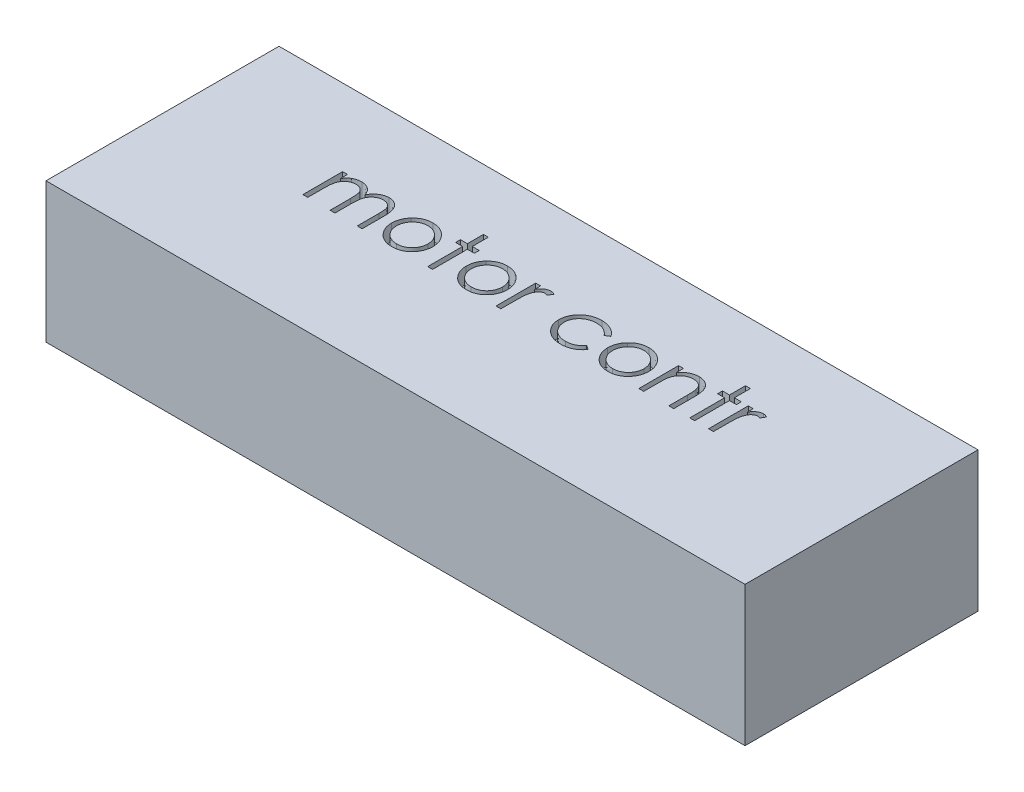
from build123d import *

# Parameters (mm, degrees)
SKETCH1_W           = 45
SKETCH1_H           = 15
BOSS_EXTRUDE1_DEPTH = 9
CUT_EXTRUDE1_DEPTH  = 1


with BuildPart() as part:
    # Sketch1 → Boss-Extrude1 (new body)
    with BuildSketch(Plane(origin=(0, 0, 0), x_dir=(1, 0, 0), z_dir=(0, 1, 0))):
        Rectangle(SKETCH1_W, SKETCH1_H)
    extrude(amount=BOSS_EXTRUDE1_DEPTH)

    # Sketch2 → Cut-Extrude1 (cut)
    # profile 1 of 10: a face of its own
    with BuildSketch(Plane(origin=(0, 9, 0), x_dir=(1, 0, 0), z_dir=(0, 1, 0))):
        with BuildLine():
            Line((-13.461538462, 2.557692308), (-13.147435897, 2.557692308))
            Line((-13.147435897, 2.557692308), (-13.147435897, 2.11318109))
            add(Edge.make_bspline(
                [(-13.147435897, 2.11318109), (-13.119151948, 2.152068691), (-13.064957188, 2.226581065), (-12.976091535, 2.324771349), (-12.887315423, 2.408099503), (-12.823382041, 2.451842375), (-12.792668269, 2.472856571)],
                knots=[0, 0, 0, 0, 1.134379233, 2.173579362, 3.122582517, 4, 4, 4, 4], degree=3))
            add(Edge.make_bspline(
                [(-12.792668269, 2.472856571), (-12.750803607, 2.492861936), (-12.667805707, 2.532523149), (-12.536386482, 2.572756708), (-12.401911813, 2.597481809), (-12.311103599, 2.600863183), (-12.265424679, 2.602564103)],
                knots=[0, 0, 0, 0, 1.014936303, 2.012140481, 3.000054389, 4, 4, 4, 4], degree=3))
            add(Edge.make_bspline(
                [(-12.265424679, 2.602564103), (-12.234531683, 2.601518812), (-12.173396104, 2.599450238), (-12.082812014, 2.585990202), (-11.994953402, 2.562724029), (-11.910339373, 2.530316705), (-11.830618693, 2.491070018), (-11.757529496, 2.445020311), (-11.691905287, 2.393323235), (-11.633779236, 2.333644302), (-11.581510211, 2.264307704), (-11.533431364, 2.183443455), (-11.489006152, 2.089235794), (-11.464384843, 2.020869253), (-11.451422276, 1.984875801)],
                knots=[0, 0, 0, 0, 1.009824226, 1.998387844, 2.986035974, 3.974953746, 4.955485308, 5.885931332, 6.793869504, 7.679848016, 8.601185859, 9.625726857, 10.749998409, 12, 12, 12, 12], degree=3))
            add(Edge.make_bspline(
                [(-11.451422276, 1.984875801), (-11.437711024, 2.009600221), (-11.410729207, 2.058254406), (-11.36542357, 2.127112668), (-11.317955774, 2.19151946), (-11.267921281, 2.251525884), (-11.215496694, 2.306835614), (-11.160435293, 2.357631516), (-11.103050512, 2.40413173), (-11.023258272, 2.458454889), (-10.919445665, 2.516156071), (-10.78855755, 2.566184515), (-10.652407378, 2.597100643), (-10.55998968, 2.600730916), (-10.513321314, 2.602564103)],
                knots=[0, 0, 0, 0, 0.86119277, 1.694706429, 2.50939023, 3.298075842, 4.073795165, 4.829715201, 5.57930267, 6.321991688, 7.768977793, 9.186738141, 10.579381044, 12, 12, 12, 12], degree=3))
            add(Edge.make_bspline(
                [(-10.513321314, 2.602564103), (-10.470439851, 2.600946882), (-10.386516665, 2.597781823), (-10.264339399, 2.57292835), (-10.150397594, 2.530250703), (-10.044920518, 2.472017066), (-9.949760704, 2.398837883), (-9.867044395, 2.311769046), (-9.797274032, 2.211426423), (-9.751695392, 2.117034434), (-9.720780128, 2.033699101), (-9.701718894, 1.96269281), (-9.684879199, 1.884541257), (-9.670897953, 1.799150995), (-9.660679401, 1.706220387), (-9.653108686, 1.605901511), (-9.647984612, 1.498116399), (-9.64762254, 1.423750899), (-9.647435897, 1.385416667)],
                knots=[0, 0, 0, 0, 1.209669288, 2.367440248, 3.500751976, 4.631527125, 5.755587489, 6.87532382, 8.007944318, 9.190864318, 9.82315674, 10.514484317, 11.263564316, 12.079023757, 12.955305781, 13.901327259, 14.918167583, 16, 16, 16, 16], degree=3))
            Line((-9.647435897, 1.385416667), (-9.647435897, 0))
            Line((-9.647435897, 0), (-9.961538462, 0))
            Line((-9.961538462, 0), (-9.961538462, 1.38681891))
            add(Edge.make_bspline(
                [(-9.961538462, 1.38681891), (-9.961616345, 1.419539484), (-9.961766024, 1.482423451), (-9.964459655, 1.572675902), (-9.969534969, 1.654944259), (-9.975469608, 1.729116348), (-9.983713418, 1.795365136), (-9.994359349, 1.853557555), (-10.005637029, 1.904151366), (-10.02437302, 1.960237414), (-10.054320912, 2.022107624), (-10.099938392, 2.0888312), (-10.157408498, 2.146912), (-10.223768655, 2.197330317), (-10.299317099, 2.238323958), (-10.382581823, 2.267599968), (-10.473045874, 2.285722846), (-10.535668663, 2.287528862), (-10.568008814, 2.288461538)],
                knots=[0, 0, 0, 0, 1.253487763, 2.409012846, 3.458416907, 4.410876679, 5.259312806, 6.014470957, 6.676830364, 7.243083969, 8.276244668, 9.299465089, 10.325150304, 11.392391894, 12.482080715, 13.603491619, 14.762376348, 16, 16, 16, 16], degree=3))
            add(Edge.make_bspline(
                [(-10.568008814, 2.288461538), (-10.607678768, 2.287045381), (-10.68608168, 2.284246516), (-10.800527166, 2.255672643), (-10.910498182, 2.212592392), (-11.012713315, 2.150159935), (-11.106741106, 2.075351571), (-11.187640684, 1.986401975), (-11.254472869, 1.885772048), (-11.299726845, 1.792625346), (-11.328316147, 1.708955902), (-11.347193062, 1.63585853), (-11.361876454, 1.552776962), (-11.375646983, 1.460269472), (-11.384634711, 1.357699291), (-11.392803083, 1.24554089), (-11.396623946, 1.123456931), (-11.397158405, 1.038830242), (-11.397435897, 0.994891827)],
                knots=[0, 0, 0, 0, 1.090531906, 2.155305635, 3.229839962, 4.33261226, 5.44038871, 6.529323825, 7.629011124, 8.757537029, 9.370236727, 10.061839251, 10.834451254, 11.692844982, 12.636905849, 13.66920014, 14.789842145, 16, 16, 16, 16], degree=3))
            Line((-11.397435897, 0.994891827), (-11.397435897, 0))
            Line((-11.397435897, 0), (-11.711538462, 0))
            Line((-11.711538462, 0), (-11.711538462, 1.300580929))
            add(Edge.make_bspline(
                [(-11.711538462, 1.300580929), (-11.711617893, 1.337274248), (-11.71177071, 1.407868505), (-11.714447027, 1.509102181), (-11.719533649, 1.601183261), (-11.725414197, 1.684004725), (-11.733874376, 1.757416053), (-11.743484138, 1.821810811), (-11.754832748, 1.877027563), (-11.773622633, 1.937590947), (-11.802337101, 2.00431187), (-11.848525363, 2.075452892), (-11.906132944, 2.137720989), (-11.973703819, 2.190879738), (-12.049709502, 2.234821219), (-12.133692902, 2.266480971), (-12.224897815, 2.28490526), (-12.287775521, 2.287253757), (-12.320112179, 2.288461538)],
                knots=[0, 0, 0, 0, 1.320475261, 2.540461679, 3.643808994, 4.639130445, 5.527981419, 6.302341397, 6.981980563, 7.553956391, 8.582137848, 9.585246428, 10.591171744, 11.620968678, 12.668337649, 13.738356861, 14.836885341, 16, 16, 16, 16], degree=3))
            add(Edge.make_bspline(
                [(-12.320112179, 2.288461538), (-12.358128391, 2.286931078), (-12.43389335, 2.283880926), (-12.54519532, 2.256426652), (-12.652681004, 2.213422577), (-12.754635702, 2.153762758), (-12.848309851, 2.07986368), (-12.930318118, 1.992948784), (-12.999260644, 1.89409975), (-13.044992458, 1.801935234), (-13.074490933, 1.720361959), (-13.094086267, 1.651011011), (-13.110925893, 1.574010763), (-13.123439915, 1.489123652), (-13.13552033, 1.396902558), (-13.141350639, 1.296888068), (-13.147022202, 1.18916598), (-13.147294616, 1.114793435), (-13.147435897, 1.076221955)],
                knots=[0, 0, 0, 0, 1.098833095, 2.189935336, 3.297829714, 4.440610912, 5.596351641, 6.740013378, 7.886572111, 9.072425424, 9.705826452, 10.395263256, 11.156850408, 11.985370555, 12.878090359, 13.847760091, 14.883794034, 16, 16, 16, 16], degree=3))
            Line((-13.147435897, 1.076221955), (-13.147435897, 0))
            Line((-13.147435897, 0), (-13.461538462, 0))
            Line((-13.461538462, 0), (-13.461538462, 2.557692308))
        make_face()
    # profile 2 of 10: a face of its own
    with BuildSketch(Plane(origin=(0, 9, 0), x_dir=(1, 0, 0), z_dir=(0, 1, 0))):
        with BuildLine():
            add(Edge.make_bspline(
                [(-7.694110577, 2.602564103), (-7.646119304, 2.601542211), (-7.552020147, 2.599538533), (-7.414212261, 2.578123567), (-7.282667125, 2.545376203), (-7.156880933, 2.500104641), (-7.038464637, 2.43942269), (-6.925693393, 2.367013399), (-6.818876384, 2.281230805), (-6.754853355, 2.214872737), (-6.722355769, 2.181189904)],
                knots=[0, 0, 0, 0, 1.054011418, 2.066658804, 3.057071809, 4.030435133, 4.997543892, 5.974964718, 6.972108034, 8, 8, 8, 8], degree=3))
            add(Edge.make_bspline(
                [(-6.722355769, 2.181189904), (-6.694373815, 2.148975918), (-6.638951435, 2.085171376), (-6.567885716, 1.981715763), (-6.506664156, 1.874575662), (-6.457601195, 1.762328336), (-6.418916171, 1.645953664), (-6.391450475, 1.525051653), (-6.37511354, 1.399889306), (-6.372910573, 1.314885468), (-6.371794872, 1.271834936)],
                knots=[0, 0, 0, 0, 1.025258237, 2.030674902, 3.01204498, 3.988269485, 4.97094183, 5.956517959, 6.965070386, 8, 8, 8, 8], degree=3))
            add(Edge.make_bspline(
                [(-6.371794872, 1.271834936), (-6.372776209, 1.228534878), (-6.374715377, 1.142971945), (-6.393058994, 1.016952579), (-6.42159008, 0.894757756), (-6.462421918, 0.776899063), (-6.514780027, 0.663016235), (-6.578670715, 0.553606686), (-6.654542332, 0.448454553), (-6.740546329, 0.348452714), (-6.835598205, 0.2562865), (-6.938714353, 0.17595823), (-7.047868387, 0.107136706), (-7.16451174, 0.05170029), (-7.287579227, 0.00799059), (-7.417336295, -0.022709427), (-7.553581365, -0.04127111), (-7.646608587, -0.043654684), (-7.694110577, -0.044871795)],
                knots=[0, 0, 0, 0, 0.998656419, 1.973391657, 2.932242238, 3.890759089, 4.846373663, 5.82037756, 6.809684879, 7.83454468, 8.860553229, 9.859544525, 10.845671541, 11.83227036, 12.833544569, 13.85385346, 14.904124723, 16, 16, 16, 16], degree=3))
            add(Edge.make_bspline(
                [(-7.694110577, -0.044871795), (-7.741845296, -0.043650599), (-7.835336156, -0.041258824), (-7.972062138, -0.022781541), (-8.102051757, 0.007976441), (-8.225280356, 0.051843934), (-8.342425202, 0.107138478), (-8.452211699, 0.175750167), (-8.555411615, 0.256310322), (-8.650483599, 0.348446259), (-8.736482205, 0.448456216), (-8.812355213, 0.553606254), (-8.876245539, 0.663016348), (-8.928603743, 0.776899033), (-8.969435556, 0.894757764), (-8.997966649, 1.016952577), (-9.016310263, 1.142971945), (-9.018249432, 1.228534878), (-9.019230769, 1.271834936)],
                knots=[0, 0, 0, 0, 1.099876186, 2.154163076, 3.173186993, 4.173200201, 5.163417411, 6.152872554, 7.150605724, 8.17532212, 9.198891216, 10.186952605, 11.159729845, 12.11414092, 13.071450619, 14.029093627, 15.002601286, 16, 16, 16, 16], degree=3))
            add(Edge.make_bspline(
                [(-9.019230769, 1.271834936), (-9.018107459, 1.314651482), (-9.015883497, 1.399420884), (-8.999562988, 1.524347945), (-8.972204432, 1.645045334), (-8.933473035, 1.76097081), (-8.883957845, 1.872726246), (-8.823596557, 1.980131077), (-8.751805924, 2.083118877), (-8.696603973, 2.146840957), (-8.668669872, 2.179086538)],
                knots=[0, 0, 0, 0, 1.031353054, 2.041901799, 3.029428768, 4.008703097, 4.981709435, 5.96992636, 6.972712378, 8, 8, 8, 8], degree=3))
            add(Edge.make_bspline(
                [(-8.668669872, 2.179086538), (-8.636221281, 2.213061478), (-8.572405417, 2.279879174), (-8.465056689, 2.365411698), (-8.352562868, 2.439327772), (-8.232837942, 2.498803987), (-8.107155084, 2.545642505), (-7.974935841, 2.57820802), (-7.836660326, 2.599461375), (-7.742100705, 2.601519553), (-7.694110577, 2.602564103)],
                knots=[0, 0, 0, 0, 1.027980169, 2.021703884, 2.998553061, 3.971491411, 4.943284454, 5.930300938, 6.949603206, 8, 8, 8, 8], degree=3))
        make_face()
        with BuildLine():
            add(Edge.make_bspline(
                [(-7.695512821, 2.288461538), (-7.729450432, 2.287496947), (-7.796449561, 2.285592664), (-7.895069145, 2.27110876), (-7.990009299, 2.248161255), (-8.081450143, 2.215557199), (-8.169083316, 2.1734583), (-8.252992718, 2.12174994), (-8.333425158, 2.061116984), (-8.408807221, 1.991654312), (-8.477989534, 1.915775317), (-8.53846751, 1.834926959), (-8.589892616, 1.750420612), (-8.632732775, 1.662168401), (-8.664639964, 1.569275987), (-8.687812986, 1.472795356), (-8.702283226, 1.37252994), (-8.704169605, 1.304368921), (-8.705128205, 1.269731571)],
                knots=[0, 0, 0, 0, 1.021534396, 2.016698045, 2.994645724, 3.958388632, 4.93408049, 5.916473867, 6.921342795, 7.962252576, 8.998418191, 10.008913653, 10.997312074, 11.973003931, 12.956656626, 13.948281152, 14.957379055, 16, 16, 16, 16], degree=3))
            add(Edge.make_bspline(
                [(-8.705128205, 1.269731571), (-8.703521381, 1.224979543), (-8.700332137, 1.136155138), (-8.674396901, 1.005344015), (-8.631010621, 0.879762163), (-8.572423341, 0.760145777), (-8.499017122, 0.649473499), (-8.412530056, 0.550802015), (-8.313890355, 0.465616203), (-8.204273855, 0.394935358), (-8.085919537, 0.338775602), (-7.960663216, 0.298976626), (-7.830022522, 0.273104934), (-7.740741791, 0.270533459), (-7.695512821, 0.269230769)],
                knots=[0, 0, 0, 0, 1.016792936, 2.018143844, 3.017858371, 4.030088057, 5.03801393, 6.028138512, 7.003788237, 7.991172063, 8.984598303, 9.972568034, 10.972917682, 12, 12, 12, 12], degree=3))
            add(Edge.make_bspline(
                [(-7.695512821, 0.269230769), (-7.650286452, 0.270541049), (-7.561010856, 0.273127506), (-7.430551679, 0.298846326), (-7.305637707, 0.338949987), (-7.187406319, 0.394872197), (-7.077839716, 0.465884611), (-6.978490595, 0.550320988), (-6.892741983, 0.64973484), (-6.819408379, 0.760292369), (-6.759861636, 0.879576721), (-6.716678434, 1.005367193), (-6.690680848, 1.136149235), (-6.687500019, 1.224977566), (-6.685897436, 1.269731571)],
                knots=[0, 0, 0, 0, 1.02726834, 2.027799167, 3.010890988, 4.004497153, 4.992059811, 5.971914811, 6.958719428, 7.966827853, 8.981595046, 9.981490638, 10.983022906, 12, 12, 12, 12], degree=3))
            add(Edge.make_bspline(
                [(-6.685897436, 1.269731571), (-6.686855706, 1.304369128), (-6.688741435, 1.372530554), (-6.703216399, 1.472793007), (-6.726371939, 1.569284604), (-6.758343556, 1.662136607), (-6.80099757, 1.750649112), (-6.853414363, 1.834678839), (-6.913645389, 1.916055385), (-6.98366251, 1.991409026), (-7.058965887, 2.061144062), (-7.139430926, 2.121773452), (-7.223215904, 2.173231047), (-7.310594487, 2.215917288), (-7.402047055, 2.247864628), (-7.496854184, 2.271241259), (-7.595052994, 2.285531456), (-7.661812037, 2.287478598), (-7.695512821, 2.288461538)],
                knots=[0, 0, 0, 0, 1.042956736, 2.052379634, 3.044323526, 4.02829302, 5.004299113, 5.996692471, 7.007513377, 8.048758398, 9.090003419, 10.095195979, 11.07790575, 12.047570684, 13.018257071, 13.989683339, 14.985167495, 16, 16, 16, 16], degree=3))
        make_face(mode=Mode.SUBTRACT)
    # profile 3 of 10: a face of its own
    with BuildSketch(Plane(origin=(0, 9, 0), x_dir=(1, 0, 0), z_dir=(0, 1, 0))):
        Polygon((-5.429487179, 3.58974359), (-5.115384615, 3.58974359), (-5.115384615, 2.557692308), (-4.666666667, 2.557692308), (-4.666666667, 2.243589744), (-5.115384615, 2.243589744), (-5.115384615, 0), (-5.429487179, 0), (-5.429487179, 2.243589744), (-5.878205128, 2.243589744), (-5.878205128, 2.557692308), (-5.429487179, 2.557692308), align=None)
    # profile 4 of 10: a face of its own
    with BuildSketch(Plane(origin=(0, 9, 0), x_dir=(1, 0, 0), z_dir=(0, 1, 0))):
        with BuildLine():
            add(Edge.make_bspline(
                [(-2.892828526, 2.602564103), (-2.844837253, 2.601542211), (-2.750738095, 2.599538533), (-2.612930209, 2.578123567), (-2.481385073, 2.545376203), (-2.355598881, 2.500104641), (-2.237182586, 2.43942269), (-2.124411342, 2.367013399), (-2.017594333, 2.281230805), (-1.953571304, 2.214872737), (-1.921073718, 2.181189904)],
                knots=[0, 0, 0, 0, 1.054011418, 2.066658804, 3.057071809, 4.030435133, 4.997543892, 5.974964718, 6.972108034, 8, 8, 8, 8], degree=3))
            add(Edge.make_bspline(
                [(-1.921073718, 2.181189904), (-1.893091764, 2.148975918), (-1.837669384, 2.085171376), (-1.766603665, 1.981715763), (-1.705382105, 1.874575662), (-1.656319144, 1.762328336), (-1.61763412, 1.645953664), (-1.590168424, 1.525051653), (-1.573831489, 1.399889306), (-1.571628522, 1.314885468), (-1.570512821, 1.271834936)],
                knots=[0, 0, 0, 0, 1.025258237, 2.030674902, 3.01204498, 3.988269485, 4.97094183, 5.956517959, 6.965070386, 8, 8, 8, 8], degree=3))
            add(Edge.make_bspline(
                [(-1.570512821, 1.271834936), (-1.571494158, 1.228534878), (-1.573433326, 1.142971945), (-1.591776943, 1.016952579), (-1.620308028, 0.894757756), (-1.661139867, 0.776899063), (-1.713497976, 0.663016235), (-1.777388663, 0.553606686), (-1.853260281, 0.448454553), (-1.939264277, 0.348452714), (-2.034316153, 0.2562865), (-2.137432302, 0.17595823), (-2.246586336, 0.107136706), (-2.363229689, 0.05170029), (-2.486297176, 0.00799059), (-2.616054244, -0.022709427), (-2.752299314, -0.04127111), (-2.845326535, -0.043654684), (-2.892828526, -0.044871795)],
                knots=[0, 0, 0, 0, 0.998656419, 1.973391657, 2.932242238, 3.890759089, 4.846373663, 5.82037756, 6.809684879, 7.83454468, 8.860553229, 9.859544525, 10.845671541, 11.83227036, 12.833544569, 13.85385346, 14.904124723, 16, 16, 16, 16], degree=3))
            add(Edge.make_bspline(
                [(-2.892828526, -0.044871795), (-2.940563245, -0.043650599), (-3.034054105, -0.041258824), (-3.170780087, -0.022781541), (-3.300769706, 0.007976441), (-3.423998304, 0.051843934), (-3.541143151, 0.107138478), (-3.650929648, 0.175750167), (-3.754129564, 0.256310322), (-3.849201548, 0.348446259), (-3.935200153, 0.448456216), (-4.011073162, 0.553606254), (-4.074963488, 0.663016348), (-4.127321692, 0.776899033), (-4.168153505, 0.894757764), (-4.196684597, 1.016952577), (-4.215028212, 1.142971945), (-4.216967381, 1.228534878), (-4.217948718, 1.271834936)],
                knots=[0, 0, 0, 0, 1.099876186, 2.154163076, 3.173186993, 4.173200201, 5.163417411, 6.152872554, 7.150605724, 8.17532212, 9.198891216, 10.186952605, 11.159729845, 12.11414092, 13.071450619, 14.029093627, 15.002601286, 16, 16, 16, 16], degree=3))
            add(Edge.make_bspline(
                [(-4.217948718, 1.271834936), (-4.216825408, 1.314651482), (-4.214601446, 1.399420884), (-4.198280937, 1.524347945), (-4.170922381, 1.645045334), (-4.132190984, 1.76097081), (-4.082675793, 1.872726246), (-4.022314505, 1.980131077), (-3.950523873, 2.083118877), (-3.895321921, 2.146840957), (-3.867387821, 2.179086538)],
                knots=[0, 0, 0, 0, 1.031353054, 2.041901799, 3.029428768, 4.008703097, 4.981709435, 5.96992636, 6.972712378, 8, 8, 8, 8], degree=3))
            add(Edge.make_bspline(
                [(-3.867387821, 2.179086538), (-3.834939229, 2.213061478), (-3.771123366, 2.279879174), (-3.663774638, 2.365411698), (-3.551280817, 2.439327772), (-3.431555891, 2.498803987), (-3.305873033, 2.545642505), (-3.17365379, 2.57820802), (-3.035378275, 2.599461375), (-2.940818654, 2.601519553), (-2.892828526, 2.602564103)],
                knots=[0, 0, 0, 0, 1.027980169, 2.021703884, 2.998553061, 3.971491411, 4.943284454, 5.930300938, 6.949603206, 8, 8, 8, 8], degree=3))
        make_face()
        with BuildLine():
            add(Edge.make_bspline(
                [(-2.894230769, 2.288461538), (-2.928168381, 2.287496947), (-2.995167509, 2.285592664), (-3.093787094, 2.27110876), (-3.188727248, 2.248161255), (-3.280168092, 2.215557199), (-3.367801264, 2.1734583), (-3.451710667, 2.12174994), (-3.532143107, 2.061116984), (-3.60752517, 1.991654312), (-3.676707482, 1.915775317), (-3.737185459, 1.834926959), (-3.788610565, 1.750420612), (-3.831450724, 1.662168401), (-3.863357912, 1.569275987), (-3.886530935, 1.472795356), (-3.901001175, 1.37252994), (-3.902887554, 1.304368921), (-3.903846154, 1.269731571)],
                knots=[0, 0, 0, 0, 1.021534396, 2.016698045, 2.994645724, 3.958388632, 4.93408049, 5.916473867, 6.921342795, 7.962252576, 8.998418191, 10.008913653, 10.997312074, 11.973003931, 12.956656626, 13.948281152, 14.957379055, 16, 16, 16, 16], degree=3))
            add(Edge.make_bspline(
                [(-3.903846154, 1.269731571), (-3.90223933, 1.224979543), (-3.899050086, 1.136155138), (-3.873114849, 1.005344015), (-3.829728569, 0.879762163), (-3.77114129, 0.760145777), (-3.697735071, 0.649473499), (-3.611248004, 0.550802015), (-3.512608304, 0.465616203), (-3.402991804, 0.394935358), (-3.284637486, 0.338775602), (-3.159381165, 0.298976626), (-3.028740471, 0.273104934), (-2.93945974, 0.270533459), (-2.894230769, 0.269230769)],
                knots=[0, 0, 0, 0, 1.016792936, 2.018143844, 3.017858371, 4.030088057, 5.03801393, 6.028138512, 7.003788237, 7.991172063, 8.984598303, 9.972568034, 10.972917682, 12, 12, 12, 12], degree=3))
            add(Edge.make_bspline(
                [(-2.894230769, 0.269230769), (-2.8490044, 0.270541049), (-2.759728804, 0.273127506), (-2.629269627, 0.298846326), (-2.504355656, 0.338949987), (-2.386124268, 0.394872197), (-2.276557665, 0.465884611), (-2.177208543, 0.550320988), (-2.091459932, 0.64973484), (-2.018126327, 0.760292369), (-1.958579585, 0.879576721), (-1.915396383, 1.005367193), (-1.889398797, 1.136149235), (-1.886217968, 1.224977566), (-1.884615385, 1.269731571)],
                knots=[0, 0, 0, 0, 1.02726834, 2.027799167, 3.010890988, 4.004497153, 4.992059811, 5.971914811, 6.958719428, 7.966827853, 8.981595046, 9.981490638, 10.983022906, 12, 12, 12, 12], degree=3))
            add(Edge.make_bspline(
                [(-1.884615385, 1.269731571), (-1.885573655, 1.304369128), (-1.887459384, 1.372530554), (-1.901934348, 1.472793007), (-1.925089888, 1.569284604), (-1.957061505, 1.662136607), (-1.999715519, 1.750649112), (-2.052132312, 1.834678839), (-2.112363337, 1.916055385), (-2.182380458, 1.991409026), (-2.257683836, 2.061144062), (-2.338148874, 2.121773452), (-2.421933853, 2.173231047), (-2.509312436, 2.215917288), (-2.600765003, 2.247864628), (-2.695572132, 2.271241259), (-2.793770942, 2.285531456), (-2.860529986, 2.287478598), (-2.894230769, 2.288461538)],
                knots=[0, 0, 0, 0, 1.042956736, 2.052379634, 3.044323526, 4.02829302, 5.004299113, 5.996692471, 7.007513377, 8.048758398, 9.090003419, 10.095195979, 11.07790575, 12.047570684, 13.018257071, 13.989683339, 14.985167495, 16, 16, 16, 16], degree=3))
        make_face(mode=Mode.SUBTRACT)
    # profile 5 of 10: a face of its own
    with BuildSketch(Plane(origin=(0, 9, 0), x_dir=(1, 0, 0), z_dir=(0, 1, 0))):
        with BuildLine():
            Line((-1.032051282, 2.557692308), (-0.717948718, 2.557692308))
            Line((-0.717948718, 2.557692308), (-0.717948718, 2.181189904))
            add(Edge.make_bspline(
                [(-0.717948718, 2.181189904), (-0.694759959, 2.216245732), (-0.650411638, 2.283289731), (-0.576698709, 2.371959032), (-0.501195378, 2.445374079), (-0.42354019, 2.503877598), (-0.34316209, 2.547690717), (-0.261825139, 2.579783752), (-0.178249669, 2.598761067), (-0.122087745, 2.601294726), (-0.093950321, 2.602564103)],
                knots=[0, 0, 0, 0, 1.2804753, 2.448899062, 3.506932113, 4.484331642, 5.4025378, 6.288909075, 7.142734305, 8, 8, 8, 8], degree=3))
            add(Edge.make_bspline(
                [(-0.093950321, 2.602564103), (-0.072123994, 2.601373576), (-0.027214909, 2.59892399), (0.040767681, 2.581713165), (0.110811133, 2.554235143), (0.15595352, 2.52839492), (0.179487179, 2.514923878)],
                knots=[0, 0, 0, 0, 0.901110191, 1.854092781, 2.881294221, 4, 4, 4, 4], degree=3))
            Line((0.179487179, 2.514923878), (0.007011218, 2.242888622))
            add(Edge.make_bspline(
                [(0.007011218, 2.242888622), (-0.008097803, 2.249628888), (-0.036777618, 2.262423203), (-0.078732184, 2.277565213), (-0.117413521, 2.286481129), (-0.142057079, 2.287831847), (-0.153545673, 2.288461538)],
                knots=[0, 0, 0, 0, 1.180555205, 2.24091978, 3.179933427, 4, 4, 4, 4], degree=3))
            add(Edge.make_bspline(
                [(-0.153545673, 2.288461538), (-0.178751407, 2.286781501), (-0.230163797, 2.283354712), (-0.305648296, 2.256415904), (-0.378895501, 2.212890664), (-0.437067164, 2.164619552), (-0.482109417, 2.118071755), (-0.514249642, 2.077423352), (-0.543732389, 2.031844721), (-0.57190261, 1.982115037), (-0.597568904, 1.927385191), (-0.621523573, 1.868201977), (-0.643182436, 1.804496849), (-0.65553268, 1.760114328), (-0.661858974, 1.737379808)],
                knots=[0, 0, 0, 0, 1.125678352, 2.296057538, 3.5422874, 4.923748041, 5.663163013, 6.437101912, 7.23742474, 8.08941207, 8.991984279, 9.93940061, 10.944477711, 12, 12, 12, 12], degree=3))
            add(Edge.make_bspline(
                [(-0.661858974, 1.737379808), (-0.666591368, 1.717102634), (-0.677073259, 1.672190235), (-0.687264797, 1.596841711), (-0.697334315, 1.507818052), (-0.704430934, 1.404871459), (-0.711008976, 1.288259015), (-0.714719058, 1.15780307), (-0.717822199, 1.013369718), (-0.717905265, 0.912395365), (-0.717948718, 0.859575321)],
                knots=[0, 0, 0, 0, 0.566838948, 1.255505196, 2.06880316, 3.007127437, 4.065329342, 5.249902469, 6.561414163, 8, 8, 8, 8], degree=3))
            Line((-0.717948718, 0.859575321), (-0.717948718, 0))
            Line((-0.717948718, 0), (-1.032051282, 0))
            Line((-1.032051282, 0), (-1.032051282, 2.557692308))
        make_face()
    # profile 6 of 10: a face of its own
    with BuildSketch(Plane(origin=(0, 9, 0), x_dir=(1, 0, 0), z_dir=(0, 1, 0))):
        with BuildLine():
            Line((4.352564103, 2.003104968), (4.089643429, 1.83974359))
            add(Edge.make_bspline(
                [(4.089643429, 1.83974359), (4.060813564, 1.875571984), (4.004066869, 1.946094094), (3.905527633, 2.037104027), (3.800516218, 2.115271069), (3.687238171, 2.17897482), (3.565852371, 2.22819627), (3.436837519, 2.263026476), (3.300212014, 2.284730719), (3.206546815, 2.287197555), (3.158553686, 2.288461538)],
                knots=[0, 0, 0, 0, 1.026593902, 2.0206758, 2.988051866, 3.946915611, 4.916868779, 5.907761954, 6.927957743, 8, 8, 8, 8], degree=3))
            add(Edge.make_bspline(
                [(3.158553686, 2.288461538), (3.120194729, 2.287404696), (3.044647806, 2.285323274), (2.933741653, 2.272312781), (2.8280993, 2.248670773), (2.727058591, 2.217519816), (2.631338172, 2.175769526), (2.540687254, 2.12495977), (2.454301764, 2.06590973), (2.374685023, 1.997499184), (2.301856015, 1.923100516), (2.238757101, 1.843346821), (2.183820168, 1.76062693), (2.140714212, 1.672875188), (2.105439041, 1.582099134), (2.082232321, 1.486585279), (2.066767626, 1.387557271), (2.064998297, 1.320038931), (2.064102564, 1.285857372)],
                knots=[0, 0, 0, 0, 1.112346261, 2.190735716, 3.231507886, 4.247384806, 5.251966152, 6.253067467, 7.256802811, 8.280671706, 9.291813951, 10.270744147, 11.225547591, 12.165006084, 13.100104208, 14.043489273, 15.009504848, 16, 16, 16, 16], degree=3))
            add(Edge.make_bspline(
                [(2.064102564, 1.285857372), (2.065881816, 1.241088161), (2.069416347, 1.152152965), (2.097117807, 1.020874863), (2.142462214, 0.893951173), (2.204520065, 0.772283036), (2.282997199, 0.65968888), (2.375169762, 0.558705426), (2.481088846, 0.471289398), (2.599821176, 0.398816873), (2.72857892, 0.340555505), (2.865969024, 0.299048172), (3.010868805, 0.2739958), (3.110075552, 0.270839857), (3.160657051, 0.269230769)],
                knots=[0, 0, 0, 0, 0.966302908, 1.919585723, 2.883856336, 3.870342332, 4.860282998, 5.839159637, 6.814385684, 7.815993281, 8.834850808, 9.858348828, 10.908058873, 12, 12, 12, 12], degree=3))
            add(Edge.make_bspline(
                [(3.160657051, 0.269230769), (3.207012236, 0.270530266), (3.298112474, 0.273084123), (3.431279759, 0.294613087), (3.55805967, 0.32985672), (3.678447701, 0.37900437), (3.792223867, 0.442531886), (3.898653042, 0.520891057), (3.99985298, 0.611827657), (4.059349956, 0.682145629), (4.089643429, 0.717948718)],
                knots=[0, 0, 0, 0, 1.039848629, 2.043578496, 3.018386758, 3.987534228, 4.954977003, 5.934852016, 6.948509513, 8, 8, 8, 8], degree=3))
            Line((4.089643429, 0.717948718), (4.352564103, 0.545472756))
            add(Edge.make_bspline(
                [(4.352564103, 0.545472756), (4.3369764, 0.522582029), (4.305852733, 0.476876553), (4.253825108, 0.412432436), (4.197705276, 0.352110754), (4.137712179, 0.295992364), (4.07462917, 0.242734345), (4.00630126, 0.19488277), (3.934931649, 0.149747947), (3.859682491, 0.109135075), (3.781331793, 0.072628754), (3.699989803, 0.041237583), (3.61600999, 0.014267477), (3.529293614, -0.00716987), (3.439669716, -0.024280708), (3.347370082, -0.03563441), (3.2524265, -0.044109691), (3.188254349, -0.044615558), (3.155749199, -0.044871795)],
                knots=[0, 0, 0, 0, 0.954134338, 1.905101784, 2.851144739, 3.791306361, 4.734911809, 5.6936923, 6.663572882, 7.643865596, 8.638447847, 9.640600242, 10.646758161, 11.676244097, 12.717260333, 13.78922464, 14.880174919, 16, 16, 16, 16], degree=3))
            add(Edge.make_bspline(
                [(3.155749199, -0.044871795), (3.106138315, -0.043980515), (3.008900623, -0.0422336), (2.866578115, -0.023025125), (2.730564448, 0.005932491), (2.60090609, 0.047496225), (2.477582856, 0.101001001), (2.360709738, 0.166357915), (2.250673719, 0.244109705), (2.148562937, 0.332872475), (2.054781491, 0.429113115), (1.9742553, 0.532963033), (1.90441003, 0.640604081), (1.848322487, 0.754413607), (1.80367556, 0.87287898), (1.773170727, 0.99694922), (1.75344099, 1.125601474), (1.75115761, 1.213334356), (1.75, 1.2578125)],
                knots=[0, 0, 0, 0, 1.1129367, 2.181364009, 3.217532258, 4.231199276, 5.232079859, 6.230262199, 7.231623845, 8.250719726, 9.263571943, 10.242672461, 11.195837495, 12.138959767, 13.085126421, 14.0317438, 15.002148558, 16, 16, 16, 16], degree=3))
            add(Edge.make_bspline(
                [(1.75, 1.2578125), (1.750441016, 1.287990935), (1.75131827, 1.348020822), (1.761380198, 1.437115889), (1.774378671, 1.525024434), (1.796404408, 1.610632153), (1.821845039, 1.695237443), (1.854320571, 1.777820545), (1.892415966, 1.858765217), (1.935667913, 1.937862947), (1.984356659, 2.013812487), (2.038237892, 2.085566151), (2.095282228, 2.153985917), (2.15815834, 2.216709677), (2.224197994, 2.276245869), (2.29526957, 2.331003993), (2.370965421, 2.381144984), (2.450148744, 2.427595999), (2.532773455, 2.468955434), (2.618340126, 2.504588672), (2.706333155, 2.535041248), (2.796893299, 2.559150167), (2.889419472, 2.579367591), (2.98464081, 2.592085437), (3.082193032, 2.60107171), (3.148249055, 2.602062502), (3.181690705, 2.602564103)],
                knots=[0, 0, 0, 0, 0.990994727, 1.971252077, 2.943264845, 3.907940874, 4.872158414, 5.844625996, 6.82015047, 7.809835459, 8.804511986, 9.781214284, 10.756496977, 11.728388426, 12.696359165, 13.676225489, 14.672885716, 15.677705647, 16.690706858, 17.706033469, 18.721040654, 19.747369689, 20.783475414, 21.830280724, 22.901553713, 24, 24, 24, 24], degree=3))
            add(Edge.make_bspline(
                [(3.181690705, 2.602564103), (3.223570813, 2.601642212), (3.307121693, 2.599803037), (3.431062399, 2.584324385), (3.553177593, 2.560987969), (3.671324697, 2.526415139), (3.784071211, 2.484551483), (3.889606661, 2.437538769), (3.985446765, 2.382944165), (4.073374354, 2.323224051), (4.153553872, 2.255863145), (4.226808364, 2.180056188), (4.294640014, 2.096197709), (4.333096725, 2.034391978), (4.352564103, 2.003104968)],
                knots=[0, 0, 0, 0, 1.095225653, 2.184976855, 3.262915854, 4.344593502, 5.400796181, 6.407717688, 7.363229445, 8.282371371, 9.184954523, 10.097238608, 11.036792983, 12, 12, 12, 12], degree=3))
        make_face()
    # profile 7 of 10: a face of its own
    with BuildSketch(Plane(origin=(0, 9, 0), x_dir=(1, 0, 0), z_dir=(0, 1, 0))):
        with BuildLine():
            add(Edge.make_bspline(
                [(6.216145833, 2.602564103), (6.264137106, 2.601542211), (6.358236264, 2.599538533), (6.49604415, 2.578123567), (6.627589286, 2.545376203), (6.753375478, 2.500104641), (6.871791773, 2.43942269), (6.984563017, 2.367013399), (7.091380026, 2.281230805), (7.155403055, 2.214872737), (7.187900641, 2.181189904)],
                knots=[0, 0, 0, 0, 1.054011418, 2.066658804, 3.057071809, 4.030435133, 4.997543892, 5.974964718, 6.972108034, 8, 8, 8, 8], degree=3))
            add(Edge.make_bspline(
                [(7.187900641, 2.181189904), (7.215882595, 2.148975918), (7.271304975, 2.085171376), (7.342370694, 1.981715763), (7.403592254, 1.874575662), (7.452655215, 1.762328336), (7.491340239, 1.645953664), (7.518805935, 1.525051653), (7.53514287, 1.399889306), (7.537345837, 1.314885468), (7.538461538, 1.271834936)],
                knots=[0, 0, 0, 0, 1.025258237, 2.030674902, 3.01204498, 3.988269485, 4.97094183, 5.956517959, 6.965070386, 8, 8, 8, 8], degree=3))
            add(Edge.make_bspline(
                [(7.538461538, 1.271834936), (7.537480201, 1.228534878), (7.535541033, 1.142971945), (7.517197416, 1.016952579), (7.488666331, 0.894757756), (7.447834492, 0.776899063), (7.395476383, 0.663016235), (7.331585696, 0.553606686), (7.255714078, 0.448454553), (7.169710082, 0.348452714), (7.074658206, 0.2562865), (6.971542057, 0.17595823), (6.862388023, 0.107136706), (6.74574467, 0.05170029), (6.622677183, 0.00799059), (6.492920115, -0.022709427), (6.356675045, -0.04127111), (6.263647824, -0.043654684), (6.216145833, -0.044871795)],
                knots=[0, 0, 0, 0, 0.998656419, 1.973391657, 2.932242238, 3.890759089, 4.846373663, 5.82037756, 6.809684879, 7.83454468, 8.860553229, 9.859544525, 10.845671541, 11.83227036, 12.833544569, 13.85385346, 14.904124723, 16, 16, 16, 16], degree=3))
            add(Edge.make_bspline(
                [(6.216145833, -0.044871795), (6.168411114, -0.043650599), (6.074920254, -0.041258824), (5.938194272, -0.022781541), (5.808204653, 0.007976441), (5.684976055, 0.051843934), (5.567831208, 0.107138478), (5.458044711, 0.175750167), (5.354844795, 0.256310322), (5.259772811, 0.348446259), (5.173774206, 0.448456216), (5.097901197, 0.553606254), (5.034010871, 0.663016348), (4.981652667, 0.776899033), (4.940820854, 0.894757764), (4.912289762, 1.016952577), (4.893946147, 1.142971945), (4.892006978, 1.228534878), (4.891025641, 1.271834936)],
                knots=[0, 0, 0, 0, 1.099876186, 2.154163076, 3.173186993, 4.173200201, 5.163417411, 6.152872554, 7.150605724, 8.17532212, 9.198891216, 10.186952605, 11.159729845, 12.11414092, 13.071450619, 14.029093627, 15.002601286, 16, 16, 16, 16], degree=3))
            add(Edge.make_bspline(
                [(4.891025641, 1.271834936), (4.892148951, 1.314651482), (4.894372913, 1.399420884), (4.910693422, 1.524347945), (4.938051978, 1.645045334), (4.976783375, 1.76097081), (5.026298566, 1.872726246), (5.086659854, 1.980131077), (5.158450486, 2.083118877), (5.213652438, 2.146840957), (5.241586538, 2.179086538)],
                knots=[0, 0, 0, 0, 1.031353054, 2.041901799, 3.029428768, 4.008703097, 4.981709435, 5.96992636, 6.972712378, 8, 8, 8, 8], degree=3))
            add(Edge.make_bspline(
                [(5.241586538, 2.179086538), (5.274035129, 2.213061478), (5.337850993, 2.279879174), (5.445199721, 2.365411698), (5.557693542, 2.439327772), (5.677418468, 2.498803987), (5.803101326, 2.545642505), (5.935320569, 2.57820802), (6.073596084, 2.599461375), (6.168155705, 2.601519553), (6.216145833, 2.602564103)],
                knots=[0, 0, 0, 0, 1.027980169, 2.021703884, 2.998553061, 3.971491411, 4.943284454, 5.930300938, 6.949603206, 8, 8, 8, 8], degree=3))
        make_face()
        with BuildLine():
            add(Edge.make_bspline(
                [(6.21474359, 2.288461538), (6.180805978, 2.287496947), (6.11380685, 2.285592664), (6.015187265, 2.27110876), (5.920247111, 2.248161255), (5.828806267, 2.215557199), (5.741173095, 2.1734583), (5.657263692, 2.12174994), (5.576831252, 2.061116984), (5.501449189, 1.991654312), (5.432266877, 1.915775317), (5.3717889, 1.834926959), (5.320363794, 1.750420612), (5.277523635, 1.662168401), (5.245616447, 1.569275987), (5.222443424, 1.472795356), (5.207973184, 1.37252994), (5.206086805, 1.304368921), (5.205128205, 1.269731571)],
                knots=[0, 0, 0, 0, 1.021534396, 2.016698045, 2.994645724, 3.958388632, 4.93408049, 5.916473867, 6.921342795, 7.962252576, 8.998418191, 10.008913653, 10.997312074, 11.973003931, 12.956656626, 13.948281152, 14.957379055, 16, 16, 16, 16], degree=3))
            add(Edge.make_bspline(
                [(5.205128205, 1.269731571), (5.206735029, 1.224979543), (5.209924273, 1.136155138), (5.23585951, 1.005344015), (5.27924579, 0.879762163), (5.337833069, 0.760145777), (5.411239288, 0.649473499), (5.497726355, 0.550802015), (5.596366055, 0.465616203), (5.705982555, 0.394935358), (5.824336873, 0.338775602), (5.949593194, 0.298976626), (6.080233888, 0.273104934), (6.169514619, 0.270533459), (6.21474359, 0.269230769)],
                knots=[0, 0, 0, 0, 1.016792936, 2.018143844, 3.017858371, 4.030088057, 5.03801393, 6.028138512, 7.003788237, 7.991172063, 8.984598303, 9.972568034, 10.972917682, 12, 12, 12, 12], degree=3))
            add(Edge.make_bspline(
                [(6.21474359, 0.269230769), (6.259969959, 0.270541049), (6.349245555, 0.273127506), (6.479704731, 0.298846326), (6.604618703, 0.338949987), (6.722850091, 0.394872197), (6.832416694, 0.465884611), (6.931765816, 0.550320988), (7.017514427, 0.64973484), (7.090848032, 0.760292369), (7.150394774, 0.879576721), (7.193577976, 1.005367193), (7.219575562, 1.136149235), (7.222756391, 1.224977566), (7.224358974, 1.269731571)],
                knots=[0, 0, 0, 0, 1.02726834, 2.027799167, 3.010890988, 4.004497153, 4.992059811, 5.971914811, 6.958719428, 7.966827853, 8.981595046, 9.981490638, 10.983022906, 12, 12, 12, 12], degree=3))
            add(Edge.make_bspline(
                [(7.224358974, 1.269731571), (7.223400704, 1.304369128), (7.221514975, 1.372530554), (7.207040011, 1.472793007), (7.183884471, 1.569284604), (7.151912854, 1.662136607), (7.10925884, 1.750649112), (7.056842047, 1.834678839), (6.996611022, 1.916055385), (6.926593901, 1.991409026), (6.851290523, 2.061144062), (6.770825485, 2.121773452), (6.687040506, 2.173231047), (6.599661923, 2.215917288), (6.508209356, 2.247864628), (6.413402227, 2.271241259), (6.315203417, 2.285531456), (6.248444373, 2.287478598), (6.21474359, 2.288461538)],
                knots=[0, 0, 0, 0, 1.042956736, 2.052379634, 3.044323526, 4.02829302, 5.004299113, 5.996692471, 7.007513377, 8.048758398, 9.090003419, 10.095195979, 11.07790575, 12.047570684, 13.018257071, 13.989683339, 14.985167495, 16, 16, 16, 16], degree=3))
        make_face(mode=Mode.SUBTRACT)
    # profile 8 of 10: a face of its own
    with BuildSketch(Plane(origin=(0, 9, 0), x_dir=(1, 0, 0), z_dir=(0, 1, 0))):
        with BuildLine():
            Line((8.166666667, 2.557692308), (8.480769231, 2.557692308))
            Line((8.480769231, 2.557692308), (8.480769231, 2.096354167))
            add(Edge.make_bspline(
                [(8.480769231, 2.096354167), (8.514306866, 2.13819689), (8.579387817, 2.219394153), (8.68777215, 2.326114728), (8.802316051, 2.414059953), (8.922318054, 2.484163747), (9.047941064, 2.537010373), (9.178419334, 2.575176304), (9.31453404, 2.598061132), (9.407098477, 2.601051363), (9.453926282, 2.602564103)],
                knots=[0, 0, 0, 0, 1.12780773, 2.188550248, 3.19190651, 4.159438251, 5.104880172, 6.052711206, 7.014878035, 8, 8, 8, 8], degree=3))
            add(Edge.make_bspline(
                [(9.453926282, 2.602564103), (9.501256916, 2.600818907), (9.593894384, 2.597403139), (9.728772445, 2.570386448), (9.854745839, 2.524241192), (9.971365395, 2.461029122), (10.076492608, 2.382422649), (10.16881746, 2.290844867), (10.245180707, 2.185508784), (10.29637807, 2.087785627), (10.330103718, 2.001096833), (10.351336055, 1.926850083), (10.369367037, 1.844131932), (10.384998785, 1.753192343), (10.395575897, 1.653394153), (10.403918188, 1.545146461), (10.409896882, 1.42848433), (10.410134089, 1.347797703), (10.41025641, 1.306189904)],
                knots=[0, 0, 0, 0, 1.235846778, 2.418850247, 3.575807741, 4.728682307, 5.871620074, 6.994088408, 8.11269785, 9.256955736, 9.865816715, 10.540099792, 11.271859618, 12.076849838, 12.949306005, 13.892391288, 14.913166135, 16, 16, 16, 16], degree=3))
            Line((10.41025641, 1.306189904), (10.41025641, 0))
            Line((10.41025641, 0), (10.096153846, 0))
            Line((10.096153846, 0), (10.096153846, 1.203125))
            add(Edge.make_bspline(
                [(10.096153846, 1.203125), (10.095960638, 1.237947445), (10.095591064, 1.304556856), (10.094425417, 1.399925879), (10.091615611, 1.486412457), (10.087667298, 1.563809825), (10.081888267, 1.632043661), (10.075865636, 1.691252938), (10.068500659, 1.74136248), (10.061937746, 1.771527563), (10.058994391, 1.78505609)],
                knots=[0, 0, 0, 0, 1.430800155, 2.736877192, 3.918605307, 4.986035426, 5.920637409, 6.731861385, 7.431261377, 8, 8, 8, 8], degree=3))
            add(Edge.make_bspline(
                [(10.058994391, 1.78505609), (10.04836886, 1.824767275), (10.027917999, 1.901199019), (9.977384016, 2.004873372), (9.913569835, 2.09307156), (9.835671986, 2.165248281), (9.74444291, 2.221419118), (9.640135767, 2.260393073), (9.523757126, 2.284769342), (9.441902744, 2.287196474), (9.399238782, 2.288461538)],
                knots=[0, 0, 0, 0, 1.084156227, 2.086665306, 3.027808233, 3.945421172, 4.874247719, 5.839848303, 6.874090471, 8, 8, 8, 8], degree=3))
            add(Edge.make_bspline(
                [(9.399238782, 2.288461538), (9.373971098, 2.287985534), (9.323967005, 2.287043533), (9.249817034, 2.277592235), (9.17789286, 2.262133779), (9.107472651, 2.241265142), (9.039964858, 2.212602873), (8.973200566, 2.180073502), (8.909693802, 2.13952529), (8.848090405, 2.094334669), (8.790777598, 2.044255462), (8.737449259, 1.991410952), (8.689911239, 1.935135348), (8.646842564, 1.8763354), (8.6096643, 1.814203562), (8.577211212, 1.749339256), (8.549675517, 1.681657107), (8.535992825, 1.634682046), (8.529146635, 1.611177885)],
                knots=[0, 0, 0, 0, 1.023777757, 2.026029729, 3.023749952, 4.003683103, 4.997618607, 5.993177895, 7.010360494, 8.046726602, 9.087585522, 10.09234134, 11.086953743, 12.070360549, 13.043493632, 14.017870808, 15.008233677, 16, 16, 16, 16], degree=3))
            add(Edge.make_bspline(
                [(8.529146635, 1.611177885), (8.525206986, 1.593922682), (8.516630577, 1.556359007), (8.507367397, 1.494714588), (8.498959822, 1.423404613), (8.491922863, 1.342512296), (8.487617447, 1.251754421), (8.48292305, 1.151518583), (8.481213989, 1.041405094), (8.480921635, 0.964743402), (8.480769231, 0.924779647)],
                knots=[0, 0, 0, 0, 0.615963638, 1.340920617, 2.168419149, 3.115676021, 4.16674242, 5.331190069, 6.6087489, 8, 8, 8, 8], degree=3))
            Line((8.480769231, 0.924779647), (8.480769231, 0))
            Line((8.480769231, 0), (8.166666667, 0))
            Line((8.166666667, 0), (8.166666667, 2.557692308))
        make_face()
    # profile 9 of 10: a face of its own
    with BuildSketch(Plane(origin=(0, 9, 0), x_dir=(1, 0, 0), z_dir=(0, 1, 0))):
        Polygon((11.442307692, 3.58974359), (11.756410256, 3.58974359), (11.756410256, 2.557692308), (12.205128205, 2.557692308), (12.205128205, 2.243589744), (11.756410256, 2.243589744), (11.756410256, 0), (11.442307692, 0), (11.442307692, 2.243589744), (10.993589744, 2.243589744), (10.993589744, 2.557692308), (11.442307692, 2.557692308), align=None)
    # profile 10 of 10: a face of its own
    with BuildSketch(Plane(origin=(0, 9, 0), x_dir=(1, 0, 0), z_dir=(0, 1, 0))):
        with BuildLine():
            Line((12.653846154, 2.557692308), (12.967948718, 2.557692308))
            Line((12.967948718, 2.557692308), (12.967948718, 2.181189904))
            add(Edge.make_bspline(
                [(12.967948718, 2.181189904), (12.991137477, 2.216245732), (13.035485798, 2.283289731), (13.109198727, 2.371959032), (13.184702058, 2.445374079), (13.262357246, 2.503877598), (13.342735345, 2.547690717), (13.424072297, 2.579783752), (13.507647767, 2.598761067), (13.563809691, 2.601294726), (13.591947115, 2.602564103)],
                knots=[0, 0, 0, 0, 1.2804753, 2.448899062, 3.506932113, 4.484331642, 5.4025378, 6.288909075, 7.142734305, 8, 8, 8, 8], degree=3))
            add(Edge.make_bspline(
                [(13.591947115, 2.602564103), (13.613773442, 2.601373576), (13.658682527, 2.59892399), (13.726665117, 2.581713165), (13.796708569, 2.554235143), (13.841850956, 2.52839492), (13.865384615, 2.514923878)],
                knots=[0, 0, 0, 0, 0.901110191, 1.854092781, 2.881294221, 4, 4, 4, 4], degree=3))
            Line((13.865384615, 2.514923878), (13.692908654, 2.242888622))
            add(Edge.make_bspline(
                [(13.692908654, 2.242888622), (13.677799633, 2.249628888), (13.649119818, 2.262423203), (13.607165252, 2.277565213), (13.568483915, 2.286481129), (13.543840357, 2.287831847), (13.532351763, 2.288461538)],
                knots=[0, 0, 0, 0, 1.180555205, 2.24091978, 3.179933427, 4, 4, 4, 4], degree=3))
            add(Edge.make_bspline(
                [(13.532351763, 2.288461538), (13.507146029, 2.286781501), (13.455733639, 2.283354712), (13.38024914, 2.256415904), (13.307001934, 2.212890664), (13.248830272, 2.164619552), (13.203788019, 2.118071755), (13.171647794, 2.077423352), (13.142165047, 2.031844721), (13.113994826, 1.982115037), (13.088328532, 1.927385191), (13.064373863, 1.868201977), (13.042715, 1.804496849), (13.030364756, 1.760114328), (13.024038462, 1.737379808)],
                knots=[0, 0, 0, 0, 1.125678352, 2.296057538, 3.5422874, 4.923748041, 5.663163013, 6.437101912, 7.23742474, 8.08941207, 8.991984279, 9.93940061, 10.944477711, 12, 12, 12, 12], degree=3))
            add(Edge.make_bspline(
                [(13.024038462, 1.737379808), (13.019306068, 1.717102634), (13.008824176, 1.672190235), (12.998632639, 1.596841711), (12.988563121, 1.507818052), (12.981466502, 1.404871459), (12.97488846, 1.288259015), (12.971178378, 1.15780307), (12.968075237, 1.013369718), (12.967992171, 0.912395365), (12.967948718, 0.859575321)],
                knots=[0, 0, 0, 0, 0.566838948, 1.255505196, 2.06880316, 3.007127437, 4.065329342, 5.249902469, 6.561414163, 8, 8, 8, 8], degree=3))
            Line((12.967948718, 0.859575321), (12.967948718, 0))
            Line((12.967948718, 0), (12.653846154, 0))
            Line((12.653846154, 0), (12.653846154, 2.557692308))
        make_face()
    extrude(amount=-CUT_EXTRUDE1_DEPTH, mode=Mode.SUBTRACT)


solid = part.part
